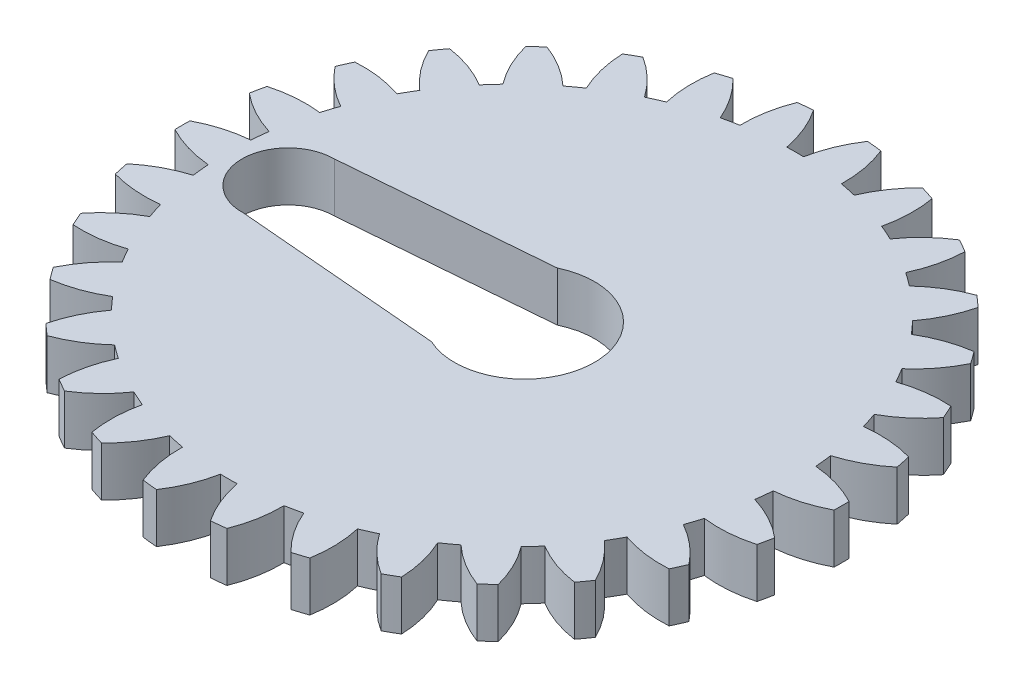
from build123d import *

# Parameters (mm, degrees)
SKETCH1_R           = 20
BOSS_EXTRUDE1_DEPTH = 3
CUT_EXTRUDE1_DEPTH  = 29.442925307
CIRPATTERN1_COUNT   = 30
CUT_EXTRUDE6_DEPTH  = 10


with BuildPart() as part:
    # Sketch1 → Boss-Extrude1 (new body)
    with BuildSketch(Plane(origin=(0, 0, 0), x_dir=(1, 0, 0), z_dir=(0, 1, 0))):
        Circle(SKETCH1_R)
    extrude(amount=BOSS_EXTRUDE1_DEPTH)

    # Sketch2 → Cut-Extrude1 (cut, through all)
    with BuildSketch(Plane(origin=(0, 3, 0), x_dir=(1, 0, 0), z_dir=(0, 1, 0))):
        with BuildLine():
            ThreePointArc((-0.506578607, 17.180033014), (0, 17.1875), (0.506578607, 17.180033014))
            ThreePointArc((0.506578607, 17.180033014), (0.934108373, 18.613100259), (1.637465265, 19.932854976))
            ThreePointArc((1.637465265, 19.932854976), (0, 20), (-1.637465265, 19.932854976))
            ThreePointArc((-1.637465265, 19.932854976), (-0.934108373, 18.613100259), (-0.506578607, 17.180033014))
        make_face()
    cut_extrude1 = extrude(amount=-CUT_EXTRUDE1_DEPTH, mode=Mode.SUBTRACT)

    # CirPattern1: Cut-Extrude1 ×30 about axis
    cirpattern1_axis = Axis((0, 0, 0), (0, 1, 0))
    for i in range(1, CIRPATTERN1_COUNT):
        add(cut_extrude1.rotate(cirpattern1_axis, i * 360 / CIRPATTERN1_COUNT), mode=Mode.SUBTRACT)

    # Sketch7 → Cut-Extrude6 (cut)
    with BuildSketch(Plane(origin=(0, 3, 0), x_dir=(1, 0, 0), z_dir=(0, 1, 0))):
        with BuildLine():
            Line((-13.617720911, 2.836798312), (-1.117720911, 3.866436729))
            ThreePointArc((-1.117720911, 3.866436729), (4.971083131, 0.060418495), (-1.071495598, -3.818570003))
            Line((-1.071495598, -3.818570003), (-13.526738457, -2.761723118))
            ThreePointArc((-13.526738457, -2.761723118), (-16.417351244, -0.008698922), (-13.617720911, 2.836798312))
        make_face()
    extrude(amount=-CUT_EXTRUDE6_DEPTH, mode=Mode.SUBTRACT)


solid = part.part
